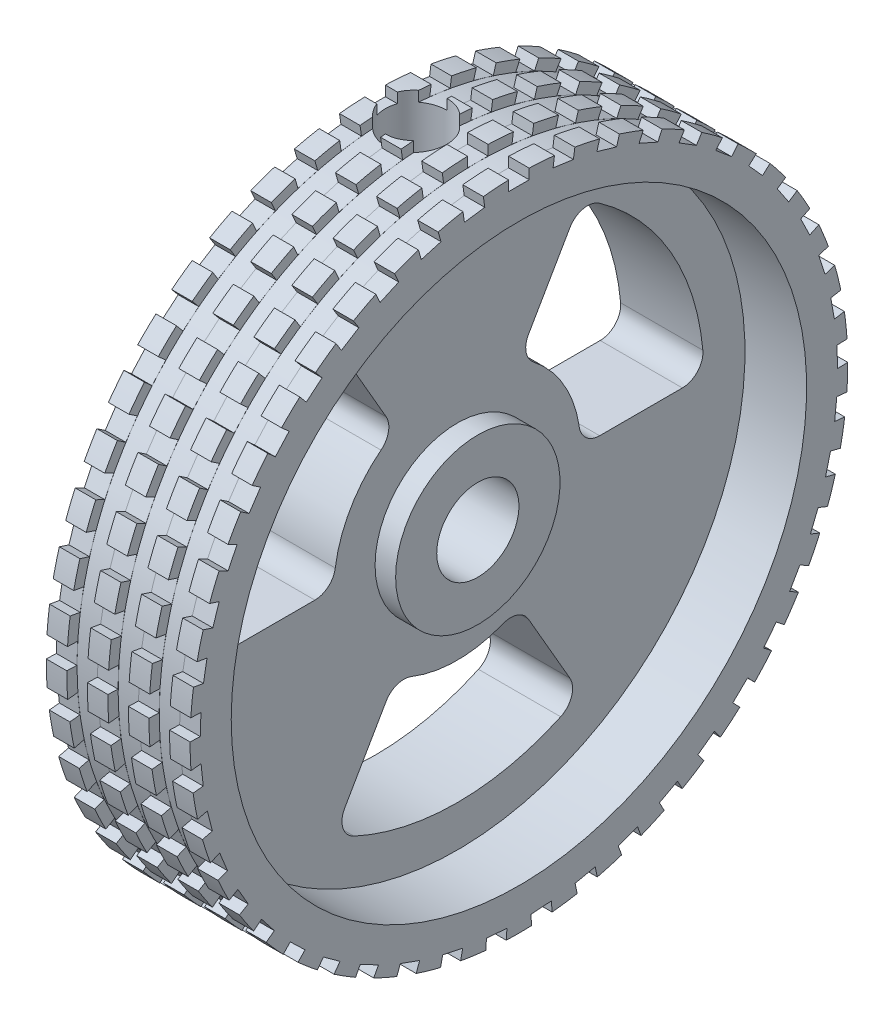
from build123d import *

# Parameters (mm, degrees)
CUT_EXTRUDE1_DEPTH       = 10
FILLET4_R                = 1
CIRPATTERN1_COUNT        = 3
FILLET4_OF_CIRPATTERN1_R = 1
SKETCH5_W                = 1
SKETCH5_H                = 0.5
CUT_EXTRUDE5_DEPTH       = 10
CIRPATTERN2_COUNT        = 45
LPATTERN1_COUNT          = 3
LPATTERN1_PITCH          = 2


with BuildPart() as part:
    # Sketch1 → Revolve1 (revolve)
    with BuildSketch(Plane(origin=(0, 0, 0), x_dir=(1, 0, 0), z_dir=(0, 1, 0))):
        Polygon((0, 2), (0, 16), (7, 16), (7, 14), (4, 14), (4, 4), (5, 4), (5, 2), align=None)
    revolve(axis=Axis((0, 0, 0), (1, 0, 0)))

    # Sketch3 → Cut-Revolve1 (revolve, cut)
    with BuildSketch(Plane.XY):
        Polygon((2, 0), (2, 16), (3.5, 16), (3.5, 11.5), (2.9, 11.5), (2.9, 0), align=None)
    revolve(axis=Axis((2, 0, 0), (0, 1, 0)), mode=Mode.SUBTRACT)

    # Sketch4 → Cut-Extrude1 (cut)
    with BuildSketch(Plane(origin=(4, 0, 0), x_dir=(0, 0, -1), z_dir=(1, 0, 0))):
        with BuildLine():
            Line((3, -5.196152423), (6, -10.392304845))
            ThreePointArc((6, -10.392304845), (0, -12), (-6, -10.392304845))
            Line((-6, -10.392304845), (-3, -5.196152423))
            ThreePointArc((-3, -5.196152423), (0, -6), (3, -5.196152423))
        make_face()
    cut_extrude1 = extrude(amount=-CUT_EXTRUDE1_DEPTH, mode=Mode.SUBTRACT)

    # Fillet4
    fillet4_edges = [part.edges().sort_by_distance(p)[0] for p in [
        (2, -10.392304845, -6),
        (2, -10.392304845, 6),
        (2, -5.196152423, -3),
        (2, -5.196152423, 3),
    ]]
    fillet(fillet4_edges, radius=FILLET4_R)

    # CirPattern1: Cut-Extrude1 ×3 about axis
    cirpattern1_axis = Axis((0, 0, 0), (-1, 0, 0))
    for i in range(1, CIRPATTERN1_COUNT):
        add(cut_extrude1.rotate(cirpattern1_axis, i * 360 / CIRPATTERN1_COUNT), mode=Mode.SUBTRACT)

    # Fillet4 of CirPattern1
    fillet4_of_cirpattern1_edges = [part.edges().sort_by_distance(p)[0] for p in [
        (2, 0, 12),
        (2, 10.392304845, 6),
        (2, 0, 6),
        (2, 5.196152423, 3),
        (2, 10.392304845, -6),
        (2, 0, -12),
        (2, 5.196152423, -3),
        (2, 0, -6),
    ]]
    fillet(fillet4_of_cirpattern1_edges, radius=FILLET4_OF_CIRPATTERN1_R)

    # Sketch5 → Cut-Revolve2 (revolve, cut)
    with BuildSketch(Plane(origin=(0, 0, 0), x_dir=(1, 0, 0), z_dir=(0, 1, 0))):
        with Locations((5.5, 15.75)):
            Rectangle(SKETCH5_W, SKETCH5_H)
    cut_revolve2 = revolve(axis=Axis((0, 0, 0), (1, 0, 0)), mode=Mode.SUBTRACT)

    # Sketch6 → Cut-Extrude5 (cut)
    with BuildSketch(Plane(origin=(7, 0, 0), x_dir=(0, 0, -1), z_dir=(1, 0, 0))):
        with BuildLine():
            Line((0, 16), (0, 15.5))
            Line((0, 15.5), (0.5, 15.5))
            Line((0.5, 15.5), (0.5, 15.992185592))
            ThreePointArc((0.5, 15.992185592), (0.250030531, 15.998046279), (0, 16))
        make_face()
        with BuildLine():
            Line((-0.5, 15.5), (0, 15.5))
            Line((0, 15.5), (0, 16))
            ThreePointArc((0, 16), (-0.250030531, 15.998046279), (-0.5, 15.992185592))
            Line((-0.5, 15.992185592), (-0.5, 15.5))
        make_face()
    cut_extrude5 = extrude(amount=-CUT_EXTRUDE5_DEPTH, mode=Mode.SUBTRACT)

    # CirPattern2: Cut-Extrude5 ×45 about axis
    cirpattern2_axis = Axis((0, 0, 0), (-1, 0, 0))
    for i in range(1, CIRPATTERN2_COUNT):
        add(cut_extrude5.rotate(cirpattern2_axis, i * 360 / CIRPATTERN2_COUNT), mode=Mode.SUBTRACT)

    # LPattern1: Cut-Revolve2 ×3
    with Locations(*[(-i * LPATTERN1_PITCH, 0, 0) for i in range(1, LPATTERN1_COUNT)]):
        add(cut_revolve2, mode=Mode.SUBTRACT)


solid = part.part
